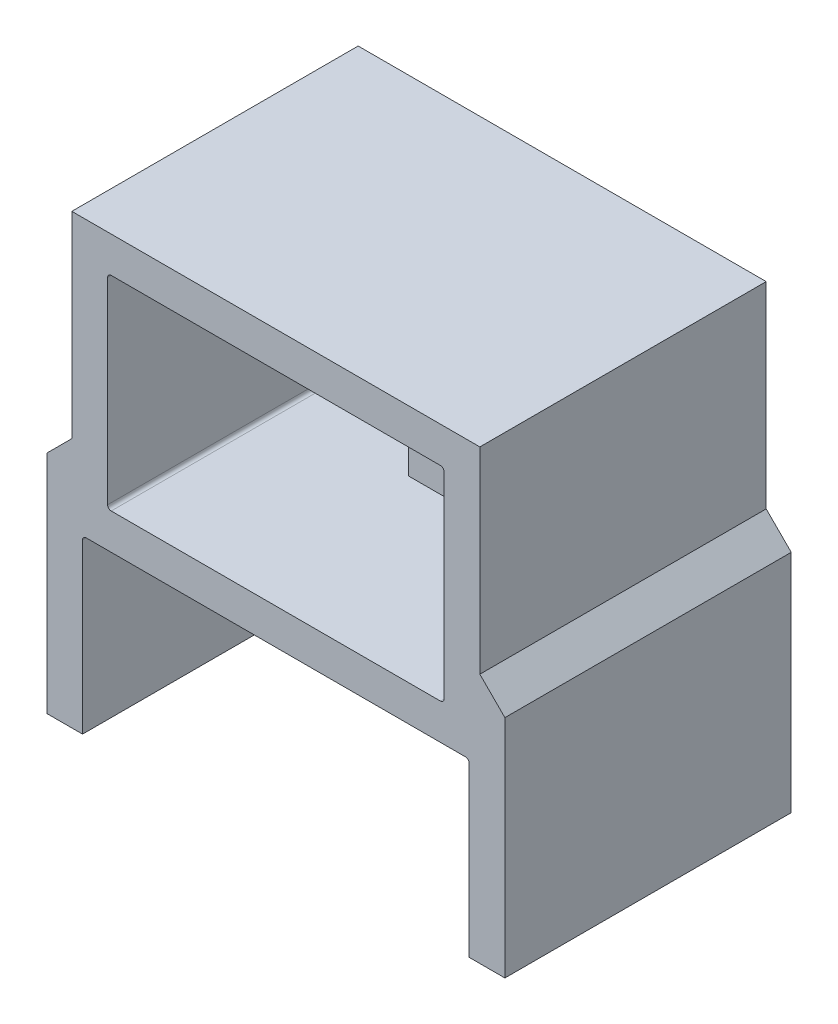
from build123d import *

# Parameters (mm, degrees)
EXTRUDE_1_DEPTH     = 8
CHAMFER_1_SIZE      = 0.7
SKETCH_3_W          = 10.8
SKETCH_3_H          = 4.8
SKETCH_3_W_2        = 9.4
SKETCH_3_H_2        = 5.7
CUT_EXTRUDE_1_DEPTH = 7.2
FILLET_1_R          = 0.1
CUT_EXTRUDE_2_REACH = 18.945
SKETCH_4_W          = 5.7
SKETCH_4_H          = 1.2
EXTRUDE_2_REACH     = 18.515
SKETCH_5_W          = 3.9
SKETCH_5_H          = 1.2
EXTRUDE_3_DEPTH     = 1
EXTRUDE_4_REACH     = 18.515
SKETCH_7_W          = 1
SKETCH_7_H          = 1


with BuildPart() as part:
    # ｽｹｯﾁ1 → ﾎﾞｽ - 押し出し1 (new body)
    with BuildSketch(Plane.XY):
        Polygon((0, 6.3), (0, 0), (12.8, 0), (12.8, 6.3), (12.1, 6.3), (12.1, 12.5), (0.7, 12.5), (0.7, 6.3), align=None)
    extrude(amount=EXTRUDE_1_DEPTH)

    # 面取り1
    chamfer_1_edges = [part.edges().sort_by_distance(p)[0] for p in [
        (0.7, 6.3, 4),
        (12.1, 6.3, 4),
    ]]
    chamfer(chamfer_1_edges, length=CHAMFER_1_SIZE - 0.0001)  # a hair under: the kernel refuses the full size

    # ｽｹｯﾁ3 → ｶｯﾄ - 押し出し1 (cut)
    with BuildSketch(Plane.XY.offset(8)):
        with Locations((6.4, 2.4)):
            Rectangle(SKETCH_3_W, SKETCH_3_H)
        with Locations((6.4, 8.65)):
            Rectangle(SKETCH_3_W_2, SKETCH_3_H_2)
    extrude(amount=-CUT_EXTRUDE_1_DEPTH, mode=Mode.SUBTRACT)

    # ﾌｨﾚｯﾄ1
    fillet_1_edges = [part.edges().sort_by_distance(p)[0] for p in [
        (1, 4.8, 4.4),
        (11.8, 4.8, 4.4),
        (11.1, 11.5, 4.4),
        (11.1, 5.8, 4.4),
        (1.7, 5.8, 4.4),
        (1.7, 11.5, 4.4),
    ]]
    fillet(fillet_1_edges, radius=FILLET_1_R)

    # ｶｯﾄ - 押し出し2: up to this face of the body (flat: up to its plane)
    cut_extrude_2_end = Plane(part.part.faces().sort_by_distance((6.4, 11.5, 4.4))[0])
    # ｽｹｯﾁ4 → ｶｯﾄ - 押し出し2 (cut, up to the picked face)
    with BuildSketch(Plane.XZ.offset(-4.8), mode=Mode.PRIVATE) as cut_extrude_2_sk1:
        with Locations((8.95, 1.4)):
            Rectangle(SKETCH_4_W, SKETCH_4_H)
    cut_extrude_2_tool1 = split(extrude(cut_extrude_2_sk1.sketch, amount=-CUT_EXTRUDE_2_REACH, mode=Mode.PRIVATE), bisect_by=cut_extrude_2_end, keep=Keep.BOTH, mode=Mode.PRIVATE)
    add(cut_extrude_2_tool1.solids().sort_by(Axis((8.95, 4.8, 1.4), (0, 1, 0)))[0], mode=Mode.SUBTRACT)

    # ｽｹｯﾁ5 → ﾎﾞｽ - 押し出し2 (add, up to next)
    with BuildSketch(Plane(origin=(0, 5.8, 0), x_dir=(1, 0, 0), z_dir=(0, 1, 0)), mode=Mode.PRIVATE) as extrude_2_sk1:
        with Locations((8.55, -2.6)):
            Rectangle(SKETCH_5_W, SKETCH_5_H)
    extrude_2_tool1 = extrude(extrude_2_sk1.sketch, amount=EXTRUDE_2_REACH, mode=Mode.PRIVATE) - part.part
    add(extrude_2_tool1.solids().sort_by_distance((8.55, 5.8, 2.6))[0])

    # ｽｹｯﾁ6 → ﾎﾞｽ - 押し出し3 (add)
    with BuildSketch(Plane.XY.offset(0.8)):
        with BuildLine():
            Line((4.6, 4.8), (4.6, 0))
            add(Edge.make_bspline(
                [(6.1, 2.3), (6.014846431, 0.686411096), (4.6, 0)],
                knots=[0, 0, 0, 1, 1, 1], degree=2))
            Line((6.1, 2.3), (6.1, 4.8))
            Line((6.1, 4.8), (4.6, 4.8))
        make_face()
    extrude(amount=EXTRUDE_3_DEPTH)

    # ｽｹｯﾁ7 → ﾎﾞｽ - 押し出し4 (add, up to next)
    with BuildSketch(Plane(origin=(0, 5.8, 0), x_dir=(1, 0, 0), z_dir=(0, 1, 0)), mode=Mode.PRIVATE) as extrude_4_sk1:
        with Locations((5.6, -2.5)):
            Rectangle(SKETCH_7_W, SKETCH_7_H)
    extrude_4_tool1 = extrude(extrude_4_sk1.sketch, amount=EXTRUDE_4_REACH, mode=Mode.PRIVATE) - part.part
    add(extrude_4_tool1.solids().sort_by_distance((5.6, 5.8, 2.5))[0])


solid = part.part
